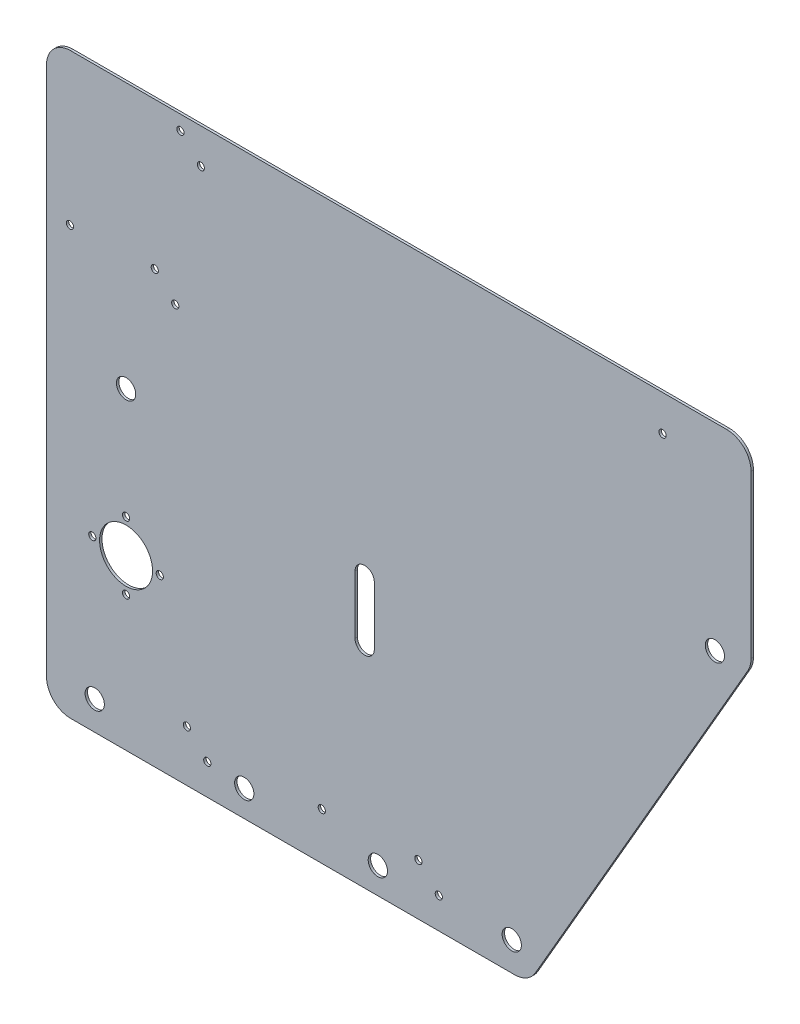
from build123d import *

# Parameters (mm, degrees)
BOSS_EXTRUDE1_DEPTH = 1
SKETCH2_R           = 4
SKETCH2_R_2         = 11
SKETCH2_R_3         = 1.5
CUT_EXTRUDE1_DEPTH  = 3
SKETCH3_W           = 292.37604307
SKETCH3_H           = 50
BOSS_EXTRUDE2_DEPTH = 1
FILLET1_R           = 10
SKETCH4_R           = 1.5
CUT_EXTRUDE2_DEPTH  = 11


with BuildPart() as part:
    # Sketch1 → Boss-Extrude1 (new body)
    with BuildSketch(Plane.XY):
        Polygon((-100, 110), (-100, -80), (100, -80), (192.37604307, 80), (192.37604307, 110), align=None)
    extrude(amount=BOSS_EXTRUDE1_DEPTH)

    # Sketch2 → Cut-Extrude1 (cut)
    with BuildSketch(Plane.XY.offset(1)):
        with Locations((93.07179677, -68)):
            Circle(SKETCH2_R)
        with Locations((177.364936071, 78)):
            Circle(SKETCH2_R)
        with Locations((-67, -10)):
            Circle(SKETCH2_R_2)
        with Locations((-80, -68)):
            Circle(SKETCH2_R)
        with Locations((-53, -10)):
            Circle(SKETCH2_R_3)
        with Locations((-67, 4)):
            Circle(SKETCH2_R_3)
        with Locations((-81, -10)):
            Circle(SKETCH2_R_3)
        with Locations((-67, -24)):
            Circle(SKETCH2_R_3)
        with Locations((62.79605759, -67.242640687)):
            Circle(SKETCH2_R_3)
        with Locations((54.310776216, -58.757359313)):
            Circle(SKETCH2_R_3)
        with Locations((-33.274226936, -67.242640687)):
            Circle(SKETCH2_R_3)
        with Locations((-41.75950831, -58.757359313)):
            Circle(SKETCH2_R_3)
        with Locations((14.225855729, -60.5)):
            Circle(SKETCH2_R_3)
        with Locations((-46.588971723, 90.47428948)):
            Circle(SKETCH2_R_3)
        with Locations((-55.074253097, 98.959570854)):
            Circle(SKETCH2_R_3)
        with Locations((-90.295627115, 97.216930167)):
            Circle(SKETCH2_R_3)
        with Locations((155.651799279, 145.145615666)):
            Circle(SKETCH2_R_3)
        with Locations((-17.947932492, -69.117445741)):
            Circle(SKETCH2_R)
        with Locations((37.494421294, -69.117445741)):
            Circle(SKETCH2_R)
        with Locations((-67, 50)):
            Circle(SKETCH2_R)
        with BuildLine():
            Line((36.026164778, 32), (36.026164778, 7.777585682))
            ThreePointArc((36.026164778, 7.777585682), (32.026164778, 3.777585682), (28.026164778, 7.777585682))
            Line((28.026164778, 7.777585682), (28.026164778, 32))
            ThreePointArc((28.026164778, 32), (32.026164778, 36), (36.026164778, 32))
        make_face()
    extrude(amount=-CUT_EXTRUDE1_DEPTH, mode=Mode.SUBTRACT)

    # Sketch3 → Boss-Extrude2 (add)
    with BuildSketch(Plane.XY.offset(1)):
        with Locations((46.188021535, 135)):
            Rectangle(SKETCH3_W, SKETCH3_H)
    extrude(amount=-BOSS_EXTRUDE2_DEPTH)

    # Fillet1
    fillet1_edges = [part.edges().sort_by_distance(p)[0] for p in [
        (100, -80, 0.5),
        (-100, -80, 0.5),
        (-100, 160, 0.5),
        (192.37604307, 160, 0.5),
        (192.37604307, 80, 0.5),
    ]]
    fillet(fillet1_edges, radius=FILLET1_R)

    # Sketch4 → Cut-Extrude2 (cut)
    with BuildSketch(Plane.XY.offset(1)):
        with Locations((-44.442274409, 153.959570854)):
            Circle(SKETCH4_R)
        with Locations((-35.956993035, 145.47428948)):
            Circle(SKETCH4_R)
        with Locations((155.651799279, 145.145615666)):
            Circle(SKETCH4_R)
    extrude(amount=-CUT_EXTRUDE2_DEPTH, mode=Mode.SUBTRACT)


solid = part.part
